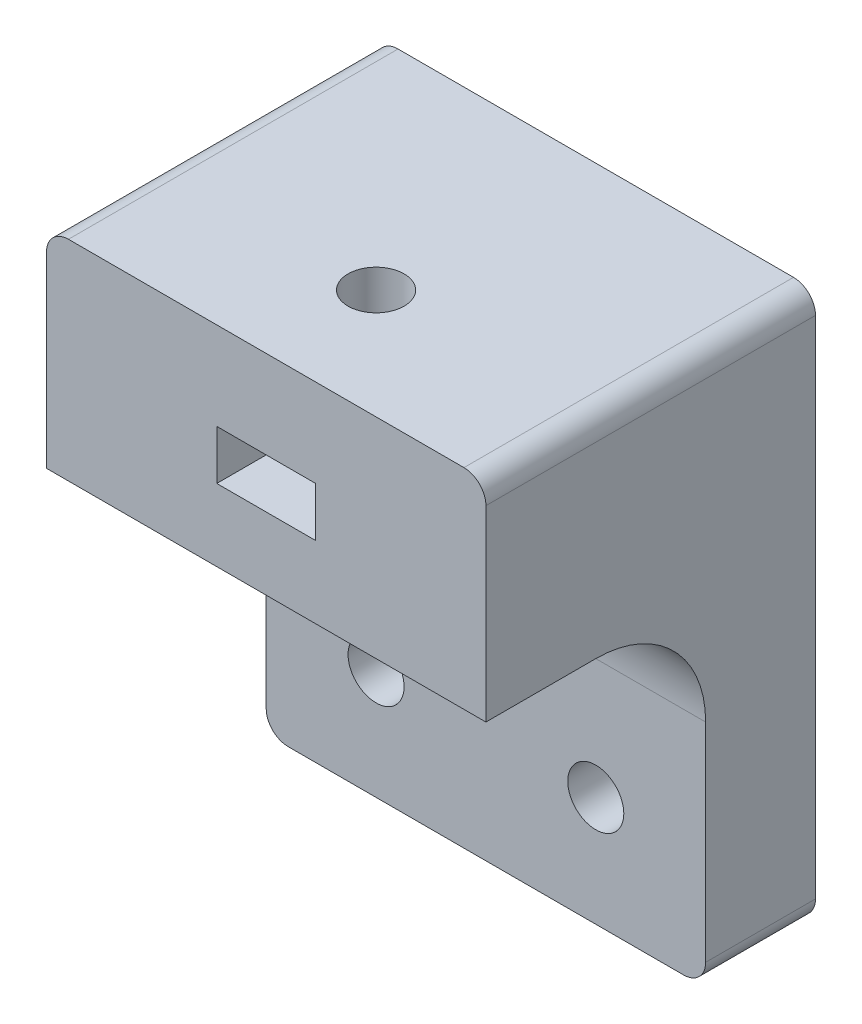
from build123d import *

# Parameters (mm, degrees)
SKETCH_1_W          = 40
SKETCH_1_H          = 30
EXTRUDE_1_DEPTH     = 50
SKETCH_2_R          = 2.55
CUT_EXTRUDE_1_DEPTH = 64.496259876
SKETCH_3_R          = 4.5
CUT_EXTRUDE_2_DEPTH = 20
SKETCH_4_R          = 2.55
CUT_EXTRUDE_3_DEPTH = 59.417154289
SKETCH_5_W          = 9
SKETCH_5_H          = 4.5
CUT_EXTRUDE_4_DEPTH = 15
SKETCH_7_W          = 40
SKETCH_7_H          = 30.941216598
CUT_EXTRUDE_5_DEPTH = 20
FILLET_1_R          = 10
FILLET_2_R          = 2


with BuildPart() as part:
    # 草图1 → 凸台-拉伸1 (new body)
    with BuildSketch(Plane(origin=(0, 0, 0), x_dir=(1, 0, 0), z_dir=(0, 1, 0))):
        with Locations((5.135135135, 1.756756757)):
            Rectangle(SKETCH_1_W, SKETCH_1_H)
    extrude(amount=EXTRUDE_1_DEPTH)

    # 草图2 → 切除-拉伸1 (cut, through all)
    with BuildSketch(Plane.XY.offset(13.243243243)):
        with Locations((-4.864864865, 10)):
            Circle(SKETCH_2_R)
        with Locations((15.135135135, 10)):
            Circle(SKETCH_2_R)
    extrude(amount=-CUT_EXTRUDE_1_DEPTH, mode=Mode.SUBTRACT)

    # 草图3 → 切除-拉伸2 (cut)
    with BuildSketch(Plane.XY.offset(13.243243243)):
        with Locations((-4.864864865, 10)):
            Circle(SKETCH_3_R)
        with Locations((15.135135135, 10)):
            Circle(SKETCH_3_R)
    extrude(amount=-CUT_EXTRUDE_2_DEPTH, mode=Mode.SUBTRACT)

    # 草图4 → 切除-拉伸3 (cut, through all)
    with BuildSketch(Plane(origin=(0, 50, 0), x_dir=(1, 0, 0), z_dir=(0, 1, 0))):
        with Locations(Location((5.135135135, -3.243243243, 0), (0, 0, 270))):
            Circle(SKETCH_4_R)
    extrude(amount=-CUT_EXTRUDE_3_DEPTH, mode=Mode.SUBTRACT)

    # 草图5 → 切除-拉伸4 (cut)
    with BuildSketch(Plane.XY.offset(13.243243243)):
        with Locations((5.135135135, 39.75)):
            Rectangle(SKETCH_5_W, SKETCH_5_H)
    extrude(amount=-CUT_EXTRUDE_4_DEPTH, mode=Mode.SUBTRACT)

    # 草图7 → 切除-拉伸5 (cut)
    with BuildSketch(Plane.XY.offset(13.243243243)):
        with Locations((5.135135135, 15.470608299)):
            Rectangle(SKETCH_7_W, SKETCH_7_H)
    extrude(amount=-CUT_EXTRUDE_5_DEPTH, mode=Mode.SUBTRACT)

    # 圆角1
    # the kernel refuses this fillet: 10 mm, written as the material it adds along each edge
    with BuildSketch(Plane(origin=(25.135135135, 30.941216598, -6.756756757), x_dir=(0, 0, 1), z_dir=(-1, 0, 0))) as fillet_1_piece_1_section:
        with BuildLine():
            CenterArc((FILLET_1_R, -FILLET_1_R), FILLET_1_R, 90, 90)
            Line((0, -FILLET_1_R), (0, 0))
            Line((0, 0), (FILLET_1_R, 0))
        make_face()
    fillet_1_piece_1 = extrude(amount=40, mode=Mode.PRIVATE)
    fillet_1_piece_1 = fillet_1_piece_1 - Plane(origin=(5.135135135, 28.670722108, 3.243243243), x_dir=(0, 0, 1), z_dir=(0, 1, 0)) * Cylinder(2.55, 120, mode=Mode.PRIVATE)
    add(fillet_1_piece_1)

    # 圆角2
    fillet_2_edges = [part.edges().sort_by_distance(p)[0] for p in [
        (25.135135135, 50, -1.756756757),
        (-14.864864865, 50, -1.756756757),
        (-14.864864865, 0, -11.756756757),
        (25.135135135, 0, -11.756756757),
    ]]
    fillet(fillet_2_edges, radius=FILLET_2_R)


solid = part.part
